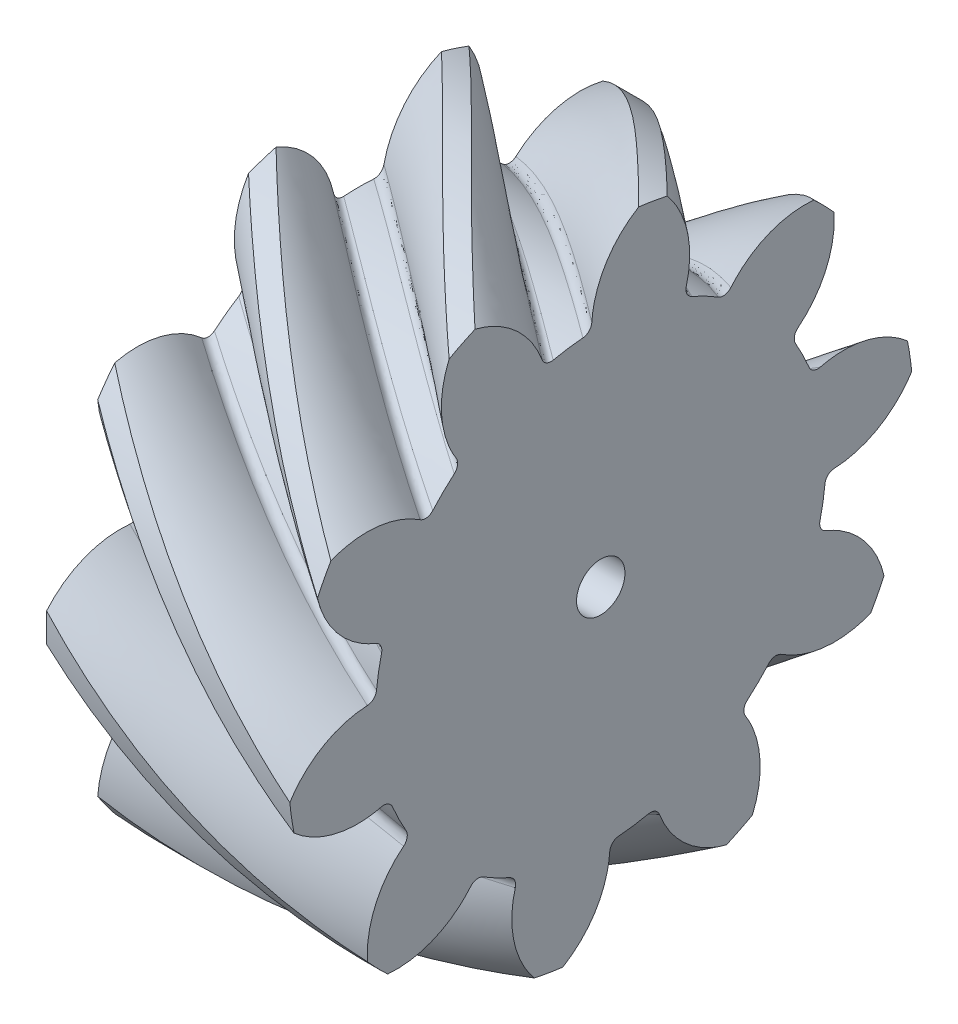
from build123d import *

# Parameters (mm, degrees)
BASPROSKE_W            = 5
BASPROSKE_H            = 6.456854249
TOOTHCUTRH_PITCH       = 40.569611751
TOOTHCUTRH_HEIGHT      = 5
TOOTHCUTRH_RADIUS      = 6.456854249
TOOTHCUTRH_START_ANGLE = -90
TEETHCUTSRH_COUNT      = 10
TEETHCUTSRH_ANGLE      = 324
BORSKE_R               = 0.5
BORE_DEPTH             = 62.5000025


with BuildPart() as part:
    # BasProSke → Base-Revolve (revolve)
    with BuildSketch(Plane(origin=(0, 0, 0), x_dir=(1, 0, 0), z_dir=(0, 1, 0)), mode=Mode.PRIVATE) as base_revolve_sk:
        with Locations((2.5, 3.228427125)):
            Rectangle(BASPROSKE_W, BASPROSKE_H)
    revolve(base_revolve_sk.sketch.rotate(Axis((-10, 0, 0), (1, 0, 0)), 180), axis=Axis((-10, 0, 0), (1, 0, 0)))

    # ToothCutRH: sweep along a helix
    with BuildLine() as toothcutrh_path:
        add(Helix(TOOTHCUTRH_PITCH, TOOTHCUTRH_HEIGHT, TOOTHCUTRH_RADIUS, center=(0, 0, 0), direction=(1, 0, 0), mode=Mode.PRIVATE).rotate(Axis((0, 0, 0), (1, 0, 0)), TOOTHCUTRH_START_ANGLE))
    # TooCutSkeRH → ToothCutRH (sweep, cut)
    with BuildSketch(Plane(origin=(0, 0, 0), x_dir=(0, 0, -1), z_dir=(1, 0, 0))):
        with BuildLine():
            ThreePointArc((0.310499314, 4.64649133), (0, 4.656854249), (-0.310499314, 4.64649133))
            ThreePointArc((-0.310499314, 4.64649133), (-0.444718542, 4.686407323), (-0.520300653, 4.80428621))
            ThreePointArc((-0.520300653, 4.80428621), (-1.056297591, 5.789023791), (-2.03797267, 6.330609297))
            ThreePointArc((-2.03797267, 6.330609297), (0, 6.650559877), (2.03797267, 6.330609297))
            ThreePointArc((2.03797267, 6.330609297), (1.056297591, 5.789023791), (0.520300653, 4.80428621))
            ThreePointArc((0.520300653, 4.80428621), (0.444718542, 4.686407323), (0.310499314, 4.64649133))
        make_face()
    toothcutrh = sweep(path=toothcutrh_path.line, is_frenet=True, mode=Mode.SUBTRACT)

    # TeethCutsRH: ToothCutRH ×10 about axis
    teethcutsrh_axis = Axis((-10, 0, 0), (1, 0, 0))
    for i in range(1, TEETHCUTSRH_COUNT):
        add(toothcutrh.rotate(teethcutsrh_axis, i * TEETHCUTSRH_ANGLE / (TEETHCUTSRH_COUNT - 1)), mode=Mode.SUBTRACT)

    # BorSke → Bore (cut, symmetric)
    with BuildSketch(Plane(origin=(0, 0, 0), x_dir=(0, 0, -1), z_dir=(1, 0, 0))):
        with Locations(Location((0, 0, 0), (0, 0, 180))):
            Circle(BORSKE_R)
    extrude(amount=BORE_DEPTH, both=True, mode=Mode.SUBTRACT)


solid = part.part
